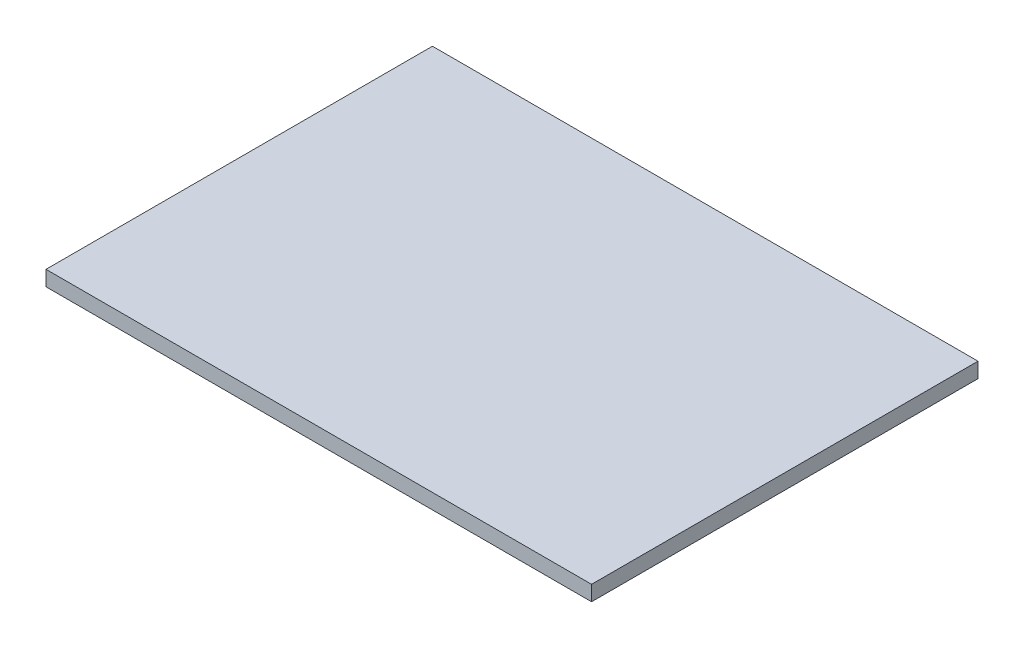
from build123d import *

# Parameters (mm, degrees)
SKETCH1_W           = 36
SKETCH1_H           = 25.5
BOSS_EXTRUDE1_DEPTH = 1


with BuildPart() as part:
    # Sketch1 → Boss-Extrude1 (new body)
    with BuildSketch(Plane(origin=(0, 0, 0), x_dir=(1, 0, 0), z_dir=(0, 1, 0))):
        Rectangle(SKETCH1_W, SKETCH1_H)
    extrude(amount=BOSS_EXTRUDE1_DEPTH)


solid = part.part
